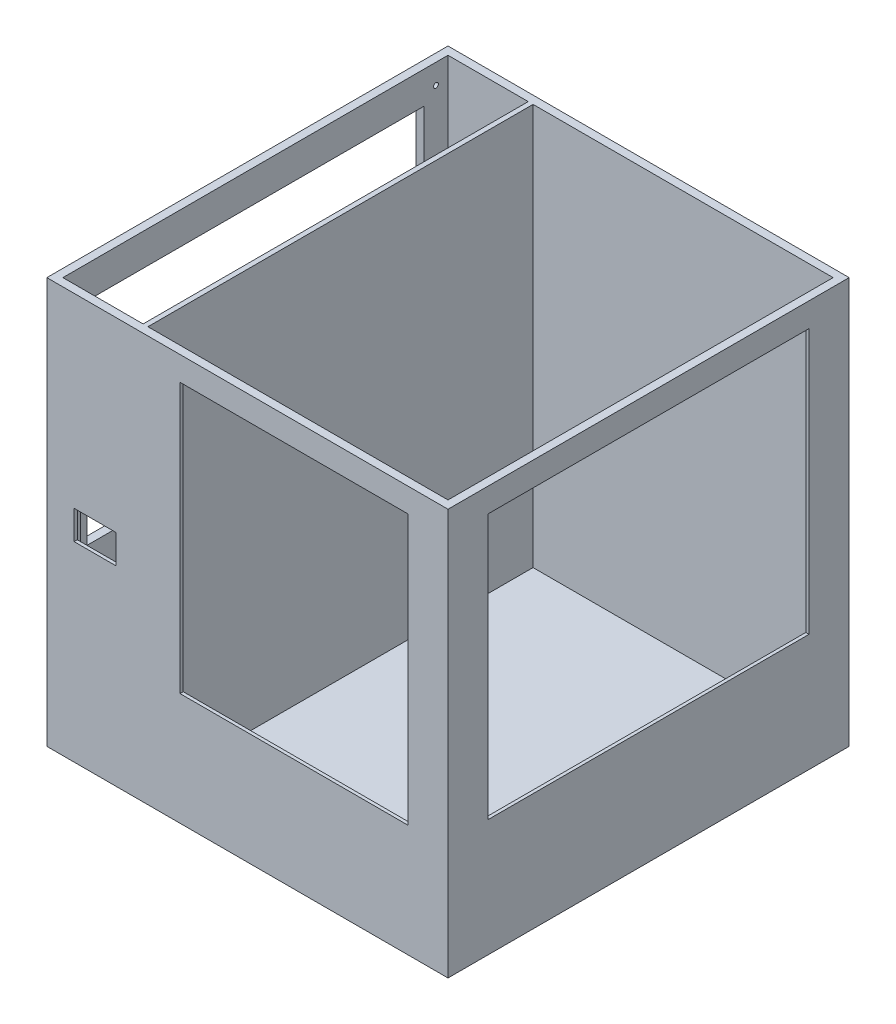
from build123d import *

# Parameters (mm, degrees)
SKETCH_1_W           = 250
SKETCH_1_H           = 250
EXTRUDE_1_DEPTH      = 3
SKETCH_2_W           = 250
SKETCH_2_H           = 250
SKETCH_2_W_2         = 240
SKETCH_2_H_2         = 240
EXTRUDE_2_DEPTH      = 250
SKETCH_3_W           = 3
SKETCH_3_H           = 240
EXTRUDE_3_DEPTH      = 250
SKETCH_8_W           = 200
SKETCH_8_H           = 165
CUT_EXTRUDE_4_DEPTH  = 8
SKETCH_9_W           = 220
SKETCH_9_H           = 185
CUT_EXTRUDE_5_DEPTH  = 3
SKETCH_11_W          = 142
SKETCH_11_H          = 168
CUT_EXTRUDE_6_DEPTH  = 10
SKETCH_12_W          = 162
SKETCH_12_H          = 188
CUT_EXTRUDE_7_DEPTH  = 3
SKETCH_16_W          = 26
SKETCH_16_H          = 18
CUT_EXTRUDE_10_DEPTH = 5
SKETCH_17_W          = 9
SKETCH_17_H          = 11
SKETCH_17_W_2        = 15
SKETCH_17_H_2        = 8
CUT_EXTRUDE_11_DEPTH = 10
SKETCH_21_W          = 28
SKETCH_21_H          = 28
CUT_EXTRUDE_14_DEPTH = 3
SKETCH_22_W          = 50
SKETCH_22_H          = 3
EXTRUDE_4_DEPTH      = 240
SKETCH_24_R          = 4
CUT_EXTRUDE_15_DEPTH = 10
SKETCH_25_W          = 210
SKETCH_25_H          = 132
CUT_EXTRUDE_16_DEPTH = 10
SKETCH_26_R          = 1.5
CUT_EXTRUDE_17_DEPTH = 10


with BuildPart() as part:
    # Эскиз1 → Бобышка-Вытянуть1 (new body)
    with BuildSketch(Plane(origin=(0, 0, 0), x_dir=(1, 0, 0), z_dir=(0, 1, 0))):
        Rectangle(SKETCH_1_W, SKETCH_1_H)
    extrude(amount=EXTRUDE_1_DEPTH)

    # Эскиз2 → Бобышка-Вытянуть2 (add)
    with BuildSketch(Plane(origin=(0, 3, 0), x_dir=(1, 0, 0), z_dir=(0, 1, 0))):
        Rectangle(SKETCH_2_W, SKETCH_2_H)
        Rectangle(SKETCH_2_W_2, SKETCH_2_H_2, mode=Mode.SUBTRACT)
    extrude(amount=EXTRUDE_2_DEPTH)

    # Эскиз3 → Бобышка-Вытянуть3 (add)
    with BuildSketch(Plane(origin=(0, 3, 0), x_dir=(1, 0, 0), z_dir=(0, 1, 0))):
        with Locations((-68.5, 0)):
            Rectangle(SKETCH_3_W, SKETCH_3_H)
    extrude(amount=EXTRUDE_3_DEPTH)

    # Эскиз8 → Вырез-Вытянуть4 (cut)
    with BuildSketch(Plane(origin=(125, 0, 0), x_dir=(0, 0, -1), z_dir=(1, 0, 0))):
        with Locations((0, 155.5)):
            Rectangle(SKETCH_8_W, SKETCH_8_H)
    extrude(amount=-CUT_EXTRUDE_4_DEPTH, mode=Mode.SUBTRACT)

    # Эскиз9 → Вырез-Вытянуть5 (cut)
    with BuildSketch(Plane.ZY.offset(-120)):
        with Locations((0, 155.5)):
            Rectangle(SKETCH_9_W, SKETCH_9_H)
    extrude(amount=-CUT_EXTRUDE_5_DEPTH, mode=Mode.SUBTRACT)

    # Эскиз11 → Вырез-Вытянуть6 (cut)
    with BuildSketch(Plane.XY.offset(125)):
        with Locations((29, 154)):
            Rectangle(SKETCH_11_W, SKETCH_11_H)
    extrude(amount=-CUT_EXTRUDE_6_DEPTH, mode=Mode.SUBTRACT)

    # Эскиз12 → Вырез-Вытянуть7 (cut)
    with BuildSketch(Plane(origin=(0, 0, 120), x_dir=(-1, 0, 0), z_dir=(0, 0, -1))):
        with Locations((-29, 154)):
            Rectangle(SKETCH_12_W, SKETCH_12_H)
    extrude(amount=-CUT_EXTRUDE_7_DEPTH, mode=Mode.SUBTRACT)

    # Эскиз16 → Вырез-Вытянуть10 (cut)
    with BuildSketch(Plane.XY.offset(125)):
        with Locations((-95, 128)):
            Rectangle(SKETCH_16_W, SKETCH_16_H)
    extrude(amount=-CUT_EXTRUDE_10_DEPTH, mode=Mode.SUBTRACT)

    # Эскиз17 → Вырез-Вытянуть11 (cut)
    with BuildSketch(Plane.ZY.offset(125)):
        with Locations((105.5, 80.5)):
            Rectangle(SKETCH_17_W, SKETCH_17_H)
        with Locations((73.5, 79)):
            Rectangle(SKETCH_17_W_2, SKETCH_17_H_2)
    extrude(amount=-CUT_EXTRUDE_11_DEPTH, mode=Mode.SUBTRACT)

    # Эскиз21 → Вырез-Вытянуть14 (cut)
    with BuildSketch(Plane(origin=(0, 0, 120), x_dir=(-1, 0, 0), z_dir=(0, 0, -1))):
        with Locations((95, 128)):
            Rectangle(SKETCH_21_W, SKETCH_21_H)
    extrude(amount=-CUT_EXTRUDE_14_DEPTH, mode=Mode.SUBTRACT)

    # Эскиз22 → Бобышка-Вытянуть4 (add)
    with BuildSketch(Plane.XY.offset(-120)):
        with Locations((-95, 71.5)):
            Rectangle(SKETCH_22_W, SKETCH_22_H)
    extrude(amount=EXTRUDE_4_DEPTH)

    # Эскиз24 → Вырез-Вытянуть15 (cut)
    with BuildSketch(Plane(origin=(-67, 0, 0), x_dir=(0, 0, -1), z_dir=(1, 0, 0))):
        with Locations((86.5, 53)):
            Circle(SKETCH_24_R)
    extrude(amount=-CUT_EXTRUDE_15_DEPTH, mode=Mode.SUBTRACT)

    # Эскиз25 → Вырез-Вытянуть16 (cut)
    with BuildSketch(Plane.ZY.offset(125)):
        with Locations((0, 167)):
            Rectangle(SKETCH_25_W, SKETCH_25_H)
    extrude(amount=-CUT_EXTRUDE_16_DEPTH, mode=Mode.SUBTRACT)

    # Эскиз26 → Вырез-Вытянуть17 (cut)
    with BuildSketch(Plane.ZY.offset(125)):
        with Locations((-112.5, 240.5)):
            Circle(SKETCH_26_R)
        with Locations((112.5, 240.5)):
            Circle(SKETCH_26_R)
        with Locations((112.5, 93.5)):
            Circle(SKETCH_26_R)
        with Locations((-112.5, 93.5)):
            Circle(SKETCH_26_R)
    extrude(amount=-CUT_EXTRUDE_17_DEPTH, mode=Mode.SUBTRACT)


solid = part.part
